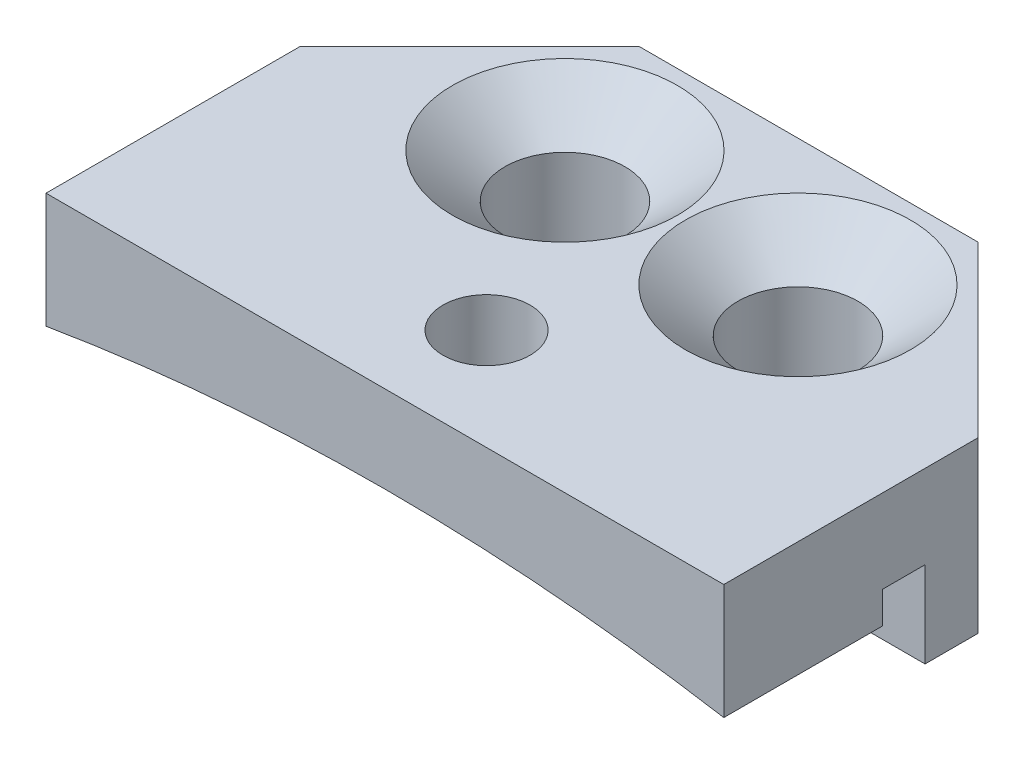
from build123d import *

# Parameters (mm, degrees)
SKETCH1_W                                         = 25.4
SKETCH1_H                                         = 15.875
BOSS_EXTRUDE1_DEPTH                               = 6.35
CHAMFER1_SIZE                                     = 6.35
CUT_EXTRUDE1_DEPTH                                = 6.746875
SKETCH3_R                                         = 1.63195
CUT_EXTRUDE2_DEPTH                                = 17.267034341
CSK_FOR_8_FLAT_HEAD_MACHINE_SCREW_100_D           = 4.4958
CSK_FOR_8_FLAT_HEAD_MACHINE_SCREW_100_CSINK_D     = 8.4328
CSK_FOR_8_FLAT_HEAD_MACHINE_SCREW_100_CSINK_ANGLE = 100
SKETCH6_W                                         = 1.5875
SKETCH6_H                                         = 3.221321103
CUT_EXTRUDE3_DEPTH                                = 28.358479749


with BuildPart() as part:
    # Sketch1 → Boss-Extrude1 (new body)
    with BuildSketch(Plane(origin=(0, 0, 0), x_dir=(1, 0, 0), z_dir=(0, 1, 0))):
        Rectangle(SKETCH1_W, SKETCH1_H)
    extrude(amount=BOSS_EXTRUDE1_DEPTH)

    # Chamfer1
    chamfer1_edges = [part.edges().sort_by_distance(p)[0] for p in [
        (12.7, 3.175, -7.9375),
        (-12.7, 3.175, -7.9375),
    ]]
    chamfer(chamfer1_edges, length=CHAMFER1_SIZE)

    # Sketch2 → Cut-Extrude1 (cut)
    with BuildSketch(Plane.XY.offset(7.9375)):
        with BuildLine():
            Line((-12.7, 2.030696103), (-12.7, 0))
            Line((-12.7, 0), (12.7, 0))
            Line((12.7, 0), (12.7, 2.030696103))
            ThreePointArc((12.7, 2.030696103), (0, 3.096482857), (-12.7, 2.030696103))
        make_face()
    extrude(amount=-CUT_EXTRUDE1_DEPTH, mode=Mode.SUBTRACT)

    # Sketch3 → Cut-Extrude2 (cut, through all)
    with BuildSketch(Plane(origin=(0, 6.35, 0), x_dir=(1, 0, 0), z_dir=(0, 1, 0))):
        with Locations((0, -4.129280278)):
            Circle(SKETCH3_R)
    extrude(amount=-CUT_EXTRUDE2_DEPTH, mode=Mode.SUBTRACT)

    # CSK for #8 Flat Head Machine Screw (100)1 (through all)
    with Locations(Plane(origin=(0, 6.35, 0), x_dir=(1, 0, 0), z_dir=(0, 1, 0))):
        with Locations((-4.365625, 3.175), (4.365625, 3.175)):
            CounterSinkHole(CSK_FOR_8_FLAT_HEAD_MACHINE_SCREW_100_D / 2, CSK_FOR_8_FLAT_HEAD_MACHINE_SCREW_100_CSINK_D / 2, counter_sink_angle=CSK_FOR_8_FLAT_HEAD_MACHINE_SCREW_100_CSINK_ANGLE)

    # Sketch6 → Cut-Extrude3 (cut, through all)
    with BuildSketch(Plane(origin=(12.7, 0, 0), x_dir=(0, 0, -1), z_dir=(1, 0, 0))):
        with Locations((-1.190625, 1.610660552)):
            Rectangle(SKETCH6_W, SKETCH6_H)
    extrude(amount=-CUT_EXTRUDE3_DEPTH, mode=Mode.SUBTRACT)


solid = part.part
